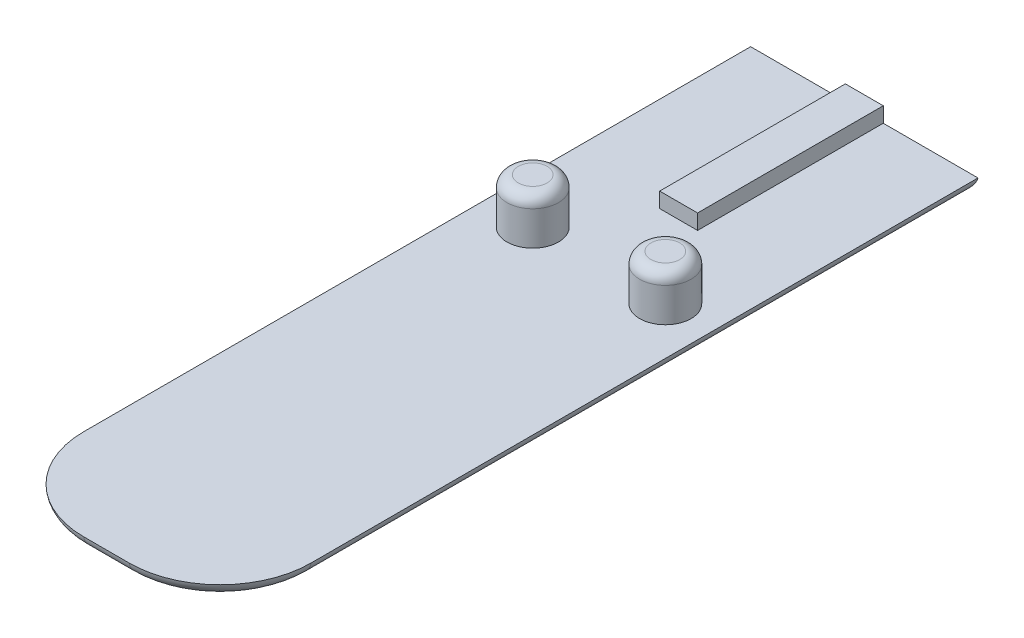
from build123d import *

# Parameters (mm, degrees)
SKETCH1_W           = 30
SKETCH1_H           = 100
BOSS_EXTRUDE1_DEPTH = 1.7
FILLET2_R           = 12
FILLET3_R           = 2
BOSS_EXTRUDE2_DEPTH = 2
SKETCH4_R           = 3.4
BOSS_EXTRUDE3_DEPTH = 6
FILLET4_R           = 1.5


with BuildPart() as part:
    # Sketch1 → Boss-Extrude1 (new body)
    with BuildSketch(Plane(origin=(0, 0, 0), x_dir=(1, 0, 0), z_dir=(0, 1, 0))):
        Rectangle(SKETCH1_W, SKETCH1_H)
    extrude(amount=BOSS_EXTRUDE1_DEPTH)

    # Fillet2
    fillet2_edges = [part.edges().sort_by_distance(p)[0] for p in [
        (-15, 0.85, 50),
        (15, 0.85, 50),
    ]]
    fillet(fillet2_edges, radius=FILLET2_R)

    # Fillet3
    # the kernel refuses this fillet: 2 mm, written as the material it takes off along each edge
    with BuildSketch(Plane(origin=(19.943429983, 0, -50), x_dir=(0, 0, 1), z_dir=(-1, 0, 0))) as fillet3_piece_1:
        with BuildLine():
            CenterArc((1.977371993, 2), FILLET3_R, 188.626926559, 81.373073441)
            Line((0, 1.7), (-0.03954744, 1.694))
            ThreePointArc((-0.03954744, 1.694), (-0.04, 0.85), (-0.04, 0))
            Line((-0.04, 0), (0, -0.04))
            Line((0, -0.04), (1.977371993, -0.04))
            Line((1.977371993, -0.04), (1.977371993, 0))
        make_face()
    extrude(amount=39.886859967, mode=Mode.SUBTRACT)
    with BuildSketch(Plane(origin=(-15, 0, -54.943429983), x_dir=(1, 0, 0), z_dir=(0, 0, 1)), Plane(origin=(15, 0, 38), x_dir=(-1, 0, 0), z_dir=(0, 0, -1))) as fillet3_piece_2:
        with BuildLine():
            CenterArc((1.977371993, 2), FILLET3_R, 188.626926559, 81.373073441)
            Line((0, 1.7), (-0.03954744, 1.694))
            ThreePointArc((-0.03954744, 1.694), (-0.04, 0.85), (-0.04, 0))
            Line((-0.04, 0), (0, -0.04))
            Line((0, -0.04), (1.977371993, -0.04))
            Line((1.977371993, -0.04), (1.977371993, 0))
        make_face()
    extrude(amount=92.943429983, mode=Mode.SUBTRACT)
    with BuildSketch(Plane(origin=(-3, 0, 38), x_dir=(0, 0, 1), z_dir=(1, 0, 0))) as fillet3_piece_3:
        with BuildLine():
            CenterArc((10.022628007, -2), FILLET3_R, 8.626926559, 81.373073441)
            Line((12, -1.7), (12.03954744, -1.694))
            ThreePointArc((12.03954744, -1.694), (12.04, -0.85), (12.04, 0))
            Line((12.04, 0), (12, 0.04))
            Line((12, 0.04), (10.022628007, 0.04))
            Line((10.022628007, 0.04), (10.022628007, 0))
        make_face()
    revolve(axis=Axis((-3, 0, 38), (0, -1, 0)), revolution_arc=90, mode=Mode.SUBTRACT)
    with BuildSketch(Plane(origin=(-3, 0, 50), x_dir=(0, 1, 0), z_dir=(1, 0, 0))) as fillet3_piece_4:
        with BuildLine():
            CenterArc((2, -1.977371993), FILLET3_R, 98.626926559, 81.373073441)
            Line((0, -1.977371993), (-0.04, -1.977371993))
            Line((-0.04, -1.977371993), (-0.04, 0))
            Line((-0.04, 0), (0, 0.04))
            ThreePointArc((0, 0.04), (0.85, 0.04), (1.694, 0.03954744))
            Line((1.694, 0.03954744), (1.7, 0))
        make_face()
    extrude(amount=6, mode=Mode.SUBTRACT)
    with BuildSketch(Plane(origin=(3, 0, 38), x_dir=(0, 0, 1), z_dir=(-1, 0, 0))) as fillet3_piece_5:
        with BuildLine():
            CenterArc((10.022628007, 2), FILLET3_R, 270, 81.373073441)
            Line((12, 1.7), (12.03954744, 1.694))
            ThreePointArc((12.03954744, 1.694), (12.04, 0.85), (12.04, 0))
            Line((12.04, 0), (12, -0.04))
            Line((12, -0.04), (10.022628007, -0.04))
            Line((10.022628007, -0.04), (10.022628007, 0))
        make_face()
    revolve(axis=Axis((3, 0, 38), (0, 1, 0)), revolution_arc=90, mode=Mode.SUBTRACT)

    # Sketch3 → Boss-Extrude2 (add)
    with BuildSketch(Plane(origin=(0, 1.7, 0), x_dir=(1, 0, 0), z_dir=(0, 1, 0))):
        Polygon((-2.5, 50), (2.5, 50), (2.5, 49.5), (2.5, 25.5), (-2.5, 25.5), (-2.5, 49.5), align=None)
    extrude(amount=BOSS_EXTRUDE2_DEPTH)

    # Sketch4 → Boss-Extrude3 (add)
    with BuildSketch(Plane(origin=(0, 1.7, 0), x_dir=(1, 0, 0), z_dir=(0, 1, 0))):
        with Locations(Location((-8.75, 15, 0), (0, 0, 270))):
            Circle(SKETCH4_R)
        with Locations(Location((8.75, 15, 0), (0, 0, 90))):
            Circle(SKETCH4_R)
    extrude(amount=BOSS_EXTRUDE3_DEPTH)

    # Fillet4
    fillet4_edges = [part.edges().sort_by_distance(p)[0] for p in [
        (-8.75, 7.7, -18.4),
        (8.75, 7.7, -11.6),
    ]]
    fillet(fillet4_edges, radius=FILLET4_R)


solid = part.part
